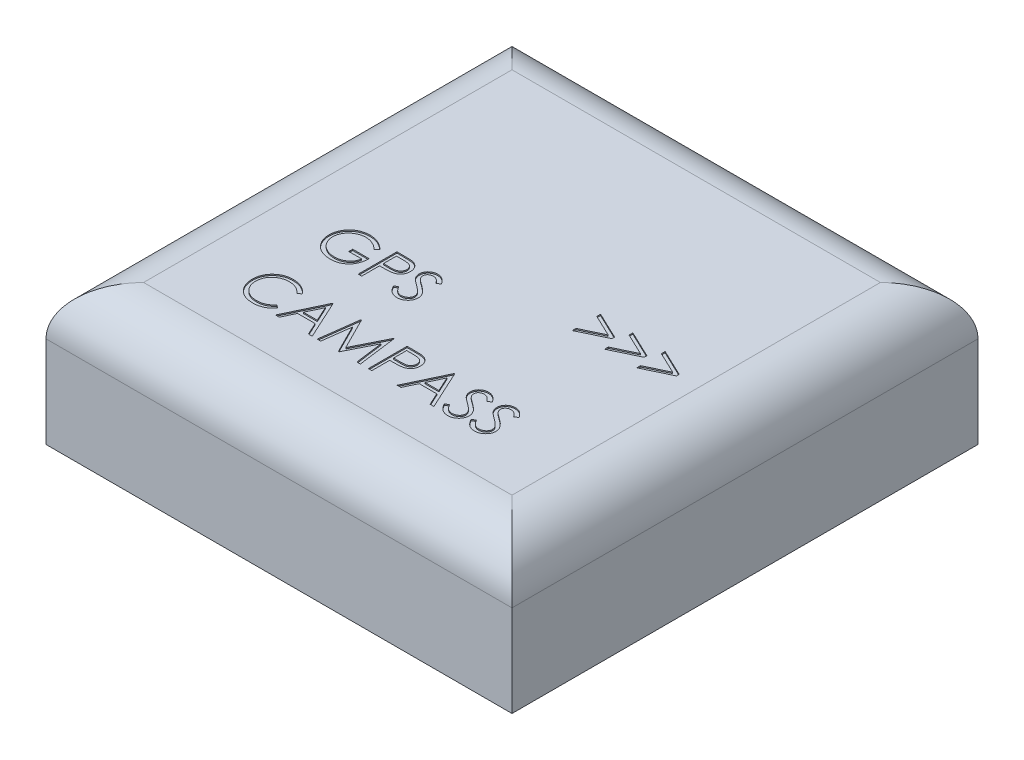
from build123d import *

# Parameters (mm, degrees)
SKETCH2_W           = 38.2
SKETCH2_H           = 38.2
BOSS_EXTRUDE1_DEPTH = 11.5
CUT_EXTRUDE1_DEPTH  = 0.1
FILLET1_R           = 4
SKETCH5_W           = 9.4
SKETCH5_H           = 4
CUT_EXTRUDE2_DEPTH  = 3


with BuildPart() as part:
    # Sketch2 → Boss-Extrude1 (new body)
    with BuildSketch(Plane(origin=(0, 0, 0), x_dir=(1, 0, 0), z_dir=(0, 1, 0))):
        Rectangle(SKETCH2_W, SKETCH2_H)
    extrude(amount=BOSS_EXTRUDE1_DEPTH)

    # Sketch4 → Cut-Extrude1 (cut)
    # profile 1 of 13: a face of its own
    with BuildSketch(Plane(origin=(0, 11.5, 0), x_dir=(1, 0, 0), z_dir=(0, 1, 0))):
        Polygon((5.884704752, -0.633123186), (7.666826146, 0.217232383), (5.884704752, 1.067587952), (5.884704752, 1.377328537), (8.082781675, 0.328535468), (8.082781675, 0.105929298), (5.884704752, -0.942863771), align=None)
    # profile 2 of 13: a face of its own
    with BuildSketch(Plane(origin=(0, 11.5, 0), x_dir=(1, 0, 0), z_dir=(0, 1, 0))):
        Polygon((8.530538085, -0.633123186), (10.312659479, 0.217232383), (8.530538085, 1.067587952), (8.530538085, 1.377328537), (10.728615008, 0.328535468), (10.728615008, 0.105929298), (8.530538085, -0.942863771), align=None)
    # profile 3 of 13: a face of its own
    with BuildSketch(Plane(origin=(0, 11.5, 0), x_dir=(1, 0, 0), z_dir=(0, 1, 0))):
        Polygon((11.176371418, -0.633123186), (12.958492813, 0.217232383), (11.176371418, 1.067587952), (11.176371418, 1.377328537), (13.374448341, 0.328535468), (13.374448341, 0.105929298), (11.176371418, -0.942863771), align=None)
    # profile 4 of 13: a face of its own
    with BuildSketch(Plane(origin=(0, 11.5, 0), x_dir=(1, 0, 0), z_dir=(0, 1, 0))):
        with BuildLine():
            Line((-7.751098915, -3.078066088), (-7.995329685, -3.309576505))
            add(Edge.make_bspline(
                [(-7.995329685, -3.309576505), (-8.039524676, -3.268001365), (-8.126860804, -3.185842468), (-8.269246167, -3.079243208), (-8.417803178, -2.987924674), (-8.571756657, -2.913624017), (-8.72729406, -2.854339727), (-8.882350878, -2.812132057), (-9.035336621, -2.785214827), (-9.137088312, -2.781995949), (-9.18722672, -2.780409838)],
                knots=[0, 0, 0, 0, 1.08915593, 2.152340314, 3.188132944, 4.216796309, 5.218260357, 6.173443236, 7.099959455, 8, 8, 8, 8], degree=3))
            add(Edge.make_bspline(
                [(-9.18722672, -2.780409838), (-9.217992198, -2.780785038), (-9.279443362, -2.781534464), (-9.370721839, -2.791099574), (-9.461043003, -2.804856272), (-9.55023635, -2.824760689), (-9.638475303, -2.849987479), (-9.725452969, -2.881542863), (-9.811331598, -2.918332264), (-9.895302257, -2.960843222), (-9.976709714, -3.007542797), (-10.053596272, -3.059293973), (-10.126451998, -3.11443809), (-10.193907527, -3.174355764), (-10.256350875, -3.238504249), (-10.315268327, -3.305690248), (-10.368587731, -3.377749339), (-10.416749002, -3.453355728), (-10.459712756, -3.5311815), (-10.497639177, -3.610477569), (-10.52947725, -3.690980923), (-10.554668113, -3.772792579), (-10.575451349, -3.855279614), (-10.590072321, -3.939013182), (-10.598315276, -4.024082939), (-10.599741105, -4.081049024), (-10.60045789, -4.109686681)],
                knots=[0, 0, 0, 0, 1.02818874, 2.053710826, 3.065248034, 4.081641283, 5.106893873, 6.131558223, 7.173050175, 8.228653731, 9.27666206, 10.308777013, 11.325269123, 12.329503258, 13.32196095, 14.316845687, 15.314881793, 16.315733098, 17.311955233, 18.285320748, 19.252783886, 20.203351036, 21.145449891, 22.095197417, 23.042428769, 24, 24, 24, 24], degree=3))
            add(Edge.make_bspline(
                [(-10.60045789, -4.109686681), (-10.599772345, -4.138960922), (-10.598403128, -4.197429467), (-10.589639839, -4.284691233), (-10.573376363, -4.370656991), (-10.551634227, -4.455609226), (-10.524437345, -4.539693429), (-10.490534998, -4.622545063), (-10.450379774, -4.704161061), (-10.403900902, -4.783806042), (-10.352931989, -4.861387642), (-10.295833623, -4.934466636), (-10.235181522, -5.00401617), (-10.168766056, -5.068492042), (-10.098716899, -5.129618862), (-10.022941192, -5.185712514), (-9.94292896, -5.237853473), (-9.858558132, -5.285384602), (-9.770744179, -5.327846631), (-9.680704125, -5.365605451), (-9.588150321, -5.396701707), (-9.493569166, -5.422045558), (-9.397073413, -5.442819399), (-9.298173249, -5.456183863), (-9.197595863, -5.465881974), (-9.129797247, -5.466591061), (-9.095640181, -5.4669483)],
                knots=[0, 0, 0, 0, 0.93586088, 1.869166235, 2.799637598, 3.729985548, 4.670839027, 5.622275134, 6.589130586, 7.576015415, 8.568469353, 9.55398029, 10.53834874, 11.515998671, 12.510579167, 13.508179873, 14.527009472, 15.561807829, 16.601455013, 17.643573243, 18.680854198, 19.719860599, 20.772568776, 21.833555941, 22.908541556, 24, 24, 24, 24], degree=3))
            add(Edge.make_bspline(
                [(-9.095640181, -5.4669483), (-9.054475538, -5.466087806), (-8.973642072, -5.464398085), (-8.854818656, -5.451244251), (-8.740697299, -5.430700374), (-8.631598672, -5.400614168), (-8.527396061, -5.362238691), (-8.427707464, -5.315978591), (-8.333317745, -5.26005953), (-8.243943152, -5.196946093), (-8.161613419, -5.126629067), (-8.087360035, -5.050751597), (-8.022367341, -4.969681994), (-7.96566665, -4.883897743), (-7.918759513, -4.792688788), (-7.880257835, -4.696502106), (-7.850745492, -4.595294435), (-7.838630622, -4.525361312), (-7.832509172, -4.490025223)],
                knots=[0, 0, 0, 0, 1.13008108, 2.219097802, 3.278683437, 4.311054135, 5.322181354, 6.324827112, 7.324222904, 8.330512327, 9.32562643, 10.293043162, 11.24128371, 12.174520618, 13.111833804, 14.052305215, 15.015860969, 16, 16, 16, 16], degree=3))
            Line((-7.832509172, -4.490025223), (-8.890842505, -4.490025223))
            Line((-8.890842505, -4.490025223), (-8.890842505, -4.164384197))
            Line((-8.890842505, -4.164384197), (-7.547573274, -4.164384197))
            add(Edge.make_bspline(
                [(-7.547573274, -4.164384197), (-7.549120723, -4.225078848), (-7.552149358, -4.343869243), (-7.57339366, -4.51710656), (-7.607698639, -4.680729453), (-7.654561922, -4.83491024), (-7.715227355, -4.979430427), (-7.789043863, -5.114436749), (-7.877192858, -5.239057023), (-7.976534473, -5.35430862), (-8.088022292, -5.457114405), (-8.208643826, -5.54747122), (-8.338598361, -5.623582878), (-8.477762973, -5.685505051), (-8.62568208, -5.733832175), (-8.782697967, -5.768096391), (-8.948597705, -5.788625), (-9.062295976, -5.791247894), (-9.120444869, -5.792589325)],
                knots=[0, 0, 0, 0, 1.140356446, 2.231883559, 3.274166699, 4.278491846, 5.25512956, 6.21435461, 7.1637429, 8.11826594, 9.068280886, 10.0076534, 10.945064095, 11.891975133, 12.864533718, 13.863980011, 14.907571808, 16, 16, 16, 16], degree=3))
            add(Edge.make_bspline(
                [(-9.120444869, -5.792589325), (-9.156286206, -5.792073051), (-9.226976874, -5.791054792), (-9.331380788, -5.783818198), (-9.432906058, -5.772677961), (-9.531537894, -5.755854885), (-9.627639105, -5.735249449), (-9.720729728, -5.708863639), (-9.81116438, -5.678321319), (-9.899082838, -5.643581673), (-9.983687106, -5.603330241), (-10.065354018, -5.558599354), (-10.144535003, -5.509619662), (-10.220690703, -5.455544109), (-10.294217916, -5.396777163), (-10.36464254, -5.333201037), (-10.43235883, -5.265010093), (-10.47477725, -5.216587705), (-10.496150999, -5.192188684)],
                knots=[0, 0, 0, 0, 1.107784379, 2.184907829, 3.233506516, 4.263428166, 5.276301166, 6.270063455, 7.25232949, 8.225834625, 9.190232166, 10.146266622, 11.1027726, 12.066435141, 13.031522626, 14.010570082, 14.99756817, 16, 16, 16, 16], degree=3))
            add(Edge.make_bspline(
                [(-10.496150999, -5.192188684), (-10.527162523, -5.153480306), (-10.588670811, -5.076706069), (-10.667844568, -4.953697548), (-10.735337269, -4.826333004), (-10.790099507, -4.694257877), (-10.832860486, -4.557595705), (-10.863527586, -4.416521119), (-10.881495627, -4.270852454), (-10.884084193, -4.172277536), (-10.885393787, -4.122407034)],
                knots=[0, 0, 0, 0, 1.023165419, 2.029347347, 3.013907458, 3.994755782, 4.975994455, 5.96558838, 6.970761222, 8, 8, 8, 8], degree=3))
            add(Edge.make_bspline(
                [(-10.885393787, -4.122407034), (-10.884910971, -4.085063362), (-10.883951475, -4.010850633), (-10.8723169, -3.900671504), (-10.855624185, -3.792448733), (-10.831088643, -3.686270786), (-10.80015846, -3.582066749), (-10.761556369, -3.479788239), (-10.71661207, -3.379374898), (-10.664373799, -3.281517889), (-10.606240039, -3.187515743), (-10.543148054, -3.097746879), (-10.474201931, -3.013846084), (-10.400527598, -2.934750803), (-10.321246043, -2.861454706), (-10.237099994, -2.793279192), (-10.148024605, -2.730132809), (-10.053739641, -2.673010173), (-9.955652385, -2.621698889), (-9.853997955, -2.57671439), (-9.748807383, -2.539536668), (-9.640868742, -2.507991882), (-9.52936501, -2.484664576), (-9.415105344, -2.4677475), (-9.297494171, -2.456171813), (-9.217995773, -2.455240852), (-9.177686455, -2.454768813)],
                knots=[0, 0, 0, 0, 1.008945113, 2.00506715, 2.99143336, 3.967273523, 4.948097931, 5.927297278, 6.919902385, 7.919676788, 8.923139349, 9.905703106, 10.883022732, 11.856032218, 12.825136022, 13.798837087, 14.781400844, 15.773989409, 16.776158564, 17.77167057, 18.775803737, 19.789618931, 20.80898985, 21.851988756, 22.910860228, 24, 24, 24, 24], degree=3))
            add(Edge.make_bspline(
                [(-9.177686455, -2.454768813), (-9.144813192, -2.455294494), (-9.079629372, -2.45633686), (-8.982632458, -2.463561933), (-8.887134795, -2.475013597), (-8.792994784, -2.490640753), (-8.700533009, -2.511925672), (-8.609486069, -2.537396688), (-8.519721982, -2.567052841), (-8.431522071, -2.602421295), (-8.344293285, -2.642565654), (-8.257550616, -2.687753545), (-8.171590443, -2.738757656), (-8.086263695, -2.795729435), (-8.00103231, -2.857690392), (-7.917244384, -2.926412654), (-7.832877428, -2.999186154), (-7.778628639, -3.051512135), (-7.751098915, -3.078066088)],
                knots=[0, 0, 0, 0, 0.985871117, 1.954866573, 2.915460327, 3.869826059, 4.81536089, 5.759505086, 6.70452669, 7.649098992, 8.607881297, 9.583363685, 10.581137262, 11.603961102, 12.659522466, 13.73993555, 14.853081303, 16, 16, 16, 16], degree=3))
        make_face()
    # profile 5 of 13: a face of its own
    with BuildSketch(Plane(origin=(0, 11.5, 0), x_dir=(1, 0, 0), z_dir=(0, 1, 0))):
        with BuildLine():
            Line((-6.896291223, -2.536179069), (-6.273629965, -2.536179069))
            add(Edge.make_bspline(
                [(-6.273629965, -2.536179069), (-6.230802929, -2.536226146), (-6.148744425, -2.536316348), (-6.031074339, -2.539051154), (-5.924204083, -2.542703939), (-5.828364094, -2.547767513), (-5.743259491, -2.553751563), (-5.669275369, -2.562144484), (-5.6058302, -2.570907752), (-5.567815064, -2.579817171), (-5.550477922, -2.583880391)],
                knots=[0, 0, 0, 0, 1.415646017, 2.712440637, 3.8905458, 4.950247383, 5.884950622, 6.709939814, 7.411656543, 8, 8, 8, 8], degree=3))
            add(Edge.make_bspline(
                [(-5.550477922, -2.583880391), (-5.52853093, -2.589887446), (-5.485154101, -2.601760006), (-5.422651012, -2.625539598), (-5.363184309, -2.653735562), (-5.306549967, -2.685870136), (-5.253443935, -2.723322041), (-5.203073883, -2.764573108), (-5.15588433, -2.810575745), (-5.112140638, -2.860813988), (-5.071968001, -2.914444464), (-5.037378931, -2.972267773), (-5.008416375, -3.033310598), (-4.983575836, -3.09753048), (-4.965697452, -3.165466702), (-4.952229193, -3.23664722), (-4.943680617, -3.311064403), (-4.942861864, -3.361918712), (-4.942445069, -3.387806673)],
                knots=[0, 0, 0, 0, 0.999701418, 1.975846123, 2.934577507, 3.890451536, 4.834027766, 5.787354733, 6.749476667, 7.726910423, 8.712836071, 9.690891519, 10.682875813, 11.679750201, 12.712814741, 13.765529915, 14.8625177, 16, 16, 16, 16], degree=3))
            add(Edge.make_bspline(
                [(-4.942445069, -3.387806673), (-4.942827362, -3.413912228), (-4.943575343, -3.464989509), (-4.952552687, -3.539713395), (-4.964645075, -3.61112222), (-4.98323883, -3.67905765), (-5.007591691, -3.743116242), (-5.036159481, -3.804276931), (-5.07061597, -3.861499205), (-5.110208065, -3.914990805), (-5.154251297, -3.964801939), (-5.20255932, -4.010571646), (-5.254937106, -4.05203201), (-5.311218198, -4.089275979), (-5.371951275, -4.12143989), (-5.436215229, -4.150248302), (-5.504568639, -4.174442764), (-5.551869348, -4.187170034), (-5.575918627, -4.193641008)],
                knots=[0, 0, 0, 0, 1.121902311, 2.195077645, 3.232258892, 4.234102512, 5.217864754, 6.176164875, 7.132989551, 8.084763148, 9.034132444, 9.988522005, 10.94243251, 11.903244335, 12.886203696, 13.894208494, 14.929344452, 16, 16, 16, 16], degree=3))
            add(Edge.make_bspline(
                [(-5.575918627, -4.193641008), (-5.595809851, -4.197870998), (-5.639402626, -4.207141267), (-5.711196381, -4.217490367), (-5.79478541, -4.226323762), (-5.890055621, -4.232946937), (-5.996921499, -4.238616914), (-6.115440854, -4.243123685), (-6.245846338, -4.245600052), (-6.336806681, -4.245727771), (-6.384297032, -4.245794454)],
                knots=[0, 0, 0, 0, 0.601384939, 1.31797006, 2.144135048, 3.087295005, 4.142315834, 5.309527816, 6.595305764, 8, 8, 8, 8], degree=3))
            Line((-6.384297032, -4.245794454), (-6.611355326, -4.245794454))
            Line((-6.611355326, -4.245794454), (-6.611355326, -5.711179069))
            Line((-6.611355326, -5.711179069), (-6.896291223, -5.711179069))
            Line((-6.896291223, -5.711179069), (-6.896291223, -2.536179069))
        make_face()
        with BuildLine():
            Line((-6.611355326, -2.861820095), (-6.611355326, -3.920153428))
            Line((-6.611355326, -3.920153428), (-6.055475919, -3.927149622))
            add(Edge.make_bspline(
                [(-6.055475919, -3.927149622), (-6.028334272, -3.92716365), (-5.975937882, -3.92719073), (-5.900249308, -3.923575563), (-5.830028026, -3.919402222), (-5.765489732, -3.913291777), (-5.706605335, -3.904654637), (-5.653276648, -3.895935417), (-5.605917184, -3.883321267), (-5.550491479, -3.866336769), (-5.488730157, -3.837369324), (-5.42154031, -3.795323353), (-5.36459842, -3.74172871), (-5.315323966, -3.681469178), (-5.276220776, -3.61443211), (-5.247594983, -3.542705289), (-5.230775505, -3.467024311), (-5.228520172, -3.415237214), (-5.227380967, -3.389078708)],
                knots=[0, 0, 0, 0, 1.160613943, 2.240541288, 3.23993089, 4.169200891, 5.011653406, 5.7853311, 6.478053781, 7.106038997, 8.262395093, 9.384106736, 10.481365981, 11.59014053, 12.70357646, 13.786202915, 14.881775077, 16, 16, 16, 16], degree=3))
            add(Edge.make_bspline(
                [(-5.227380967, -3.389078708), (-5.228526367, -3.363553057), (-5.230803282, -3.312811221), (-5.247726815, -3.238444774), (-5.276165122, -3.167473813), (-5.315586461, -3.1012768), (-5.3634302, -3.0412341), (-5.419037461, -2.989075991), (-5.482277348, -2.947146304), (-5.541103958, -2.920083256), (-5.593356463, -2.903559399), (-5.638742598, -2.891998008), (-5.689987709, -2.882767279), (-5.747108481, -2.875292873), (-5.80966218, -2.868894376), (-5.878186223, -2.864552811), (-5.952421028, -2.86201149), (-6.003956331, -2.861885438), (-6.030671231, -2.861820095)],
                knots=[0, 0, 0, 0, 1.120700087, 2.227813068, 3.331159281, 4.466773991, 5.599788987, 6.693661531, 7.80175334, 8.91857717, 9.525282508, 10.207424825, 10.974604443, 11.810962634, 12.737642355, 13.736264703, 14.826523623, 16, 16, 16, 16], degree=3))
            Line((-6.030671231, -2.861820095), (-6.611355326, -2.861820095))
        make_face(mode=Mode.SUBTRACT)
    # profile 6 of 13: a face of its own
    with BuildSketch(Plane(origin=(0, 11.5, 0), x_dir=(1, 0, 0), z_dir=(0, 1, 0))):
        with BuildLine():
            Line((-4.616804044, -5.098694093), (-4.348404604, -4.937781633))
            add(Edge.make_bspline(
                [(-4.348404604, -4.937781633), (-4.323441632, -4.979568611), (-4.27561354, -5.059630848), (-4.195829093, -5.167814927), (-4.113158524, -5.259764884), (-4.026989628, -5.334945806), (-3.937848375, -5.394135868), (-3.845152841, -5.436047892), (-3.749215398, -5.462188099), (-3.68392486, -5.465363177), (-3.651329284, -5.4669483)],
                knots=[0, 0, 0, 0, 1.272034388, 2.437168799, 3.508375237, 4.49857839, 5.41946034, 6.295179144, 7.148887113, 8, 8, 8, 8], degree=3))
            add(Edge.make_bspline(
                [(-3.651329284, -5.4669483), (-3.623491918, -5.46617299), (-3.568304274, -5.464635936), (-3.487058525, -5.449866922), (-3.408153604, -5.427177348), (-3.333215768, -5.394682646), (-3.263279032, -5.355368448), (-3.201950101, -5.307882987), (-3.148931127, -5.254718786), (-3.105561431, -5.195407378), (-3.072287399, -5.131619679), (-3.046713165, -5.06614578), (-3.032520848, -4.997957151), (-3.030382936, -4.952046231), (-3.029304044, -4.928877386)],
                knots=[0, 0, 0, 0, 1.095163259, 2.171163733, 3.241058638, 4.321873601, 5.38011039, 6.391990106, 7.366004449, 8.327778327, 9.272591725, 10.192022065, 11.087607919, 12, 12, 12, 12], degree=3))
            add(Edge.make_bspline(
                [(-3.029304044, -4.928877386), (-3.030641454, -4.902442473), (-3.033360214, -4.848704156), (-3.056339485, -4.769420185), (-3.092488445, -4.690959068), (-3.125837414, -4.642425777), (-3.143151199, -4.617228748)],
                knots=[0, 0, 0, 0, 0.938893495, 1.908633276, 2.914225137, 4, 4, 4, 4], degree=3))
            add(Edge.make_bspline(
                [(-3.143151199, -4.617228748), (-3.157366685, -4.599043416), (-3.187210319, -4.560865584), (-3.238516062, -4.504037406), (-3.298719609, -4.445419269), (-3.365760691, -4.382772839), (-3.442081422, -4.319011766), (-3.525291381, -4.251095542), (-3.617515025, -4.181606969), (-3.682193854, -4.135004713), (-3.715567064, -4.110958716)],
                knots=[0, 0, 0, 0, 0.722233717, 1.516239348, 2.393582979, 3.351407094, 4.387010283, 5.505090956, 6.712668013, 8, 8, 8, 8], degree=3))
            add(Edge.make_bspline(
                [(-3.715567064, -4.110958716), (-3.74897169, -4.087165641), (-3.812838789, -4.041675091), (-3.902154789, -3.974161634), (-3.982023694, -3.912436123), (-4.052090517, -3.855917484), (-4.112324437, -3.804598049), (-4.163200102, -3.758970633), (-4.203421508, -3.71780126), (-4.225787642, -3.691093757), (-4.235829484, -3.679102747)],
                knots=[0, 0, 0, 0, 1.452282411, 2.77665338, 3.964542531, 5.026858415, 5.96415736, 6.766646006, 7.446254459, 8, 8, 8, 8], degree=3))
            add(Edge.make_bspline(
                [(-4.235829484, -3.679102747), (-4.249865293, -3.660414663), (-4.277468595, -3.623662039), (-4.3139049, -3.566217347), (-4.344873998, -3.507413385), (-4.369151256, -3.447092136), (-4.389594826, -3.386100451), (-4.403345235, -3.323642535), (-4.411955288, -3.259998645), (-4.412837018, -3.217169255), (-4.413278403, -3.195729349)],
                knots=[0, 0, 0, 0, 1.068054152, 2.10047183, 3.106115577, 4.101338837, 5.06977816, 6.043150881, 7.020423561, 8, 8, 8, 8], degree=3))
            add(Edge.make_bspline(
                [(-4.413278403, -3.195729349), (-4.412094392, -3.162138054), (-4.409751677, -3.095673453), (-4.389939208, -2.9985812), (-4.358667368, -2.905883521), (-4.314857006, -2.818498147), (-4.258380693, -2.738700436), (-4.193024702, -2.665572487), (-4.115181425, -2.604096702), (-4.029771545, -2.550382906), (-3.936284694, -2.508340531), (-3.838321517, -2.476625928), (-3.735726316, -2.458656101), (-3.666236329, -2.456077307), (-3.63097672, -2.454768813)],
                knots=[0, 0, 0, 0, 1.005424448, 1.989358655, 2.955360095, 3.929531133, 4.905563448, 5.876582895, 6.856512386, 7.866279853, 8.892233794, 9.918561126, 10.94386622, 12, 12, 12, 12], degree=3))
            add(Edge.make_bspline(
                [(-3.63097672, -2.454768813), (-3.593562429, -2.45605927), (-3.519157346, -2.458625578), (-3.409711271, -2.480939053), (-3.304336907, -2.517860377), (-3.219570517, -2.559760088), (-3.153228655, -2.601607872), (-3.102634819, -2.639725856), (-3.051365417, -2.68360899), (-2.999006896, -2.733374163), (-2.94644644, -2.789478002), (-2.892903737, -2.851536269), (-2.838253579, -2.919169716), (-2.803096478, -2.967451942), (-2.785073274, -2.992203708)],
                knots=[0, 0, 0, 0, 1.286793592, 2.559021753, 3.825965368, 5.121522368, 5.803751409, 6.523245864, 7.299691795, 8.125521123, 9.008227632, 9.944561021, 10.946284179, 12, 12, 12, 12], degree=3))
            Line((-2.785073274, -2.992203708), (-3.042660414, -3.18746112))
            add(Edge.make_bspline(
                [(-3.042660414, -3.18746112), (-3.058214224, -3.167423523), (-3.088167226, -3.128835794), (-3.133641832, -3.074796101), (-3.176503105, -3.02543258), (-3.218730968, -2.982556357), (-3.258095191, -2.943819422), (-3.296301365, -2.910654499), (-3.332799669, -2.882736638), (-3.378807152, -2.852942837), (-3.436608225, -2.823409437), (-3.509165626, -2.798418488), (-3.584990318, -2.783400682), (-3.636633627, -2.781415048), (-3.662777601, -2.780409838)],
                knots=[0, 0, 0, 0, 1.181633172, 2.275549214, 3.290209073, 4.226197932, 5.078386478, 5.862611352, 6.581680152, 7.217281963, 8.414376989, 9.595101626, 10.782541182, 12, 12, 12, 12], degree=3))
            add(Edge.make_bspline(
                [(-3.662777601, -2.780409838), (-3.695576732, -2.781509023), (-3.758826767, -2.783628698), (-3.848625052, -2.80677897), (-3.92944597, -2.843229658), (-3.998890083, -2.894315388), (-4.056708626, -2.95484086), (-4.098532864, -3.02449025), (-4.123706227, -3.101400001), (-4.126778067, -3.155049932), (-4.128342505, -3.182372979)],
                knots=[0, 0, 0, 0, 1.14458467, 2.207223713, 3.21896685, 4.227309161, 5.202851033, 6.127160689, 7.046193047, 8, 8, 8, 8], degree=3))
            add(Edge.make_bspline(
                [(-4.128342505, -3.182372979), (-4.127985883, -3.199383249), (-4.127272056, -3.233431604), (-4.117316347, -3.283733965), (-4.104526241, -3.333909252), (-4.084258282, -3.38373188), (-4.056277185, -3.434073192), (-4.019533204, -3.485800054), (-3.973256843, -3.539368389), (-3.93780841, -3.574209364), (-3.919092705, -3.592604349)],
                knots=[0, 0, 0, 0, 0.858281714, 1.717966888, 2.583508476, 3.4729293, 4.427298488, 5.488583878, 6.674047936, 8, 8, 8, 8], degree=3))
            add(Edge.make_bspline(
                [(-3.919092705, -3.592604349), (-3.912142746, -3.598806509), (-3.895631234, -3.613541419), (-3.865445216, -3.637664416), (-3.82558282, -3.667421217), (-3.777084966, -3.704239711), (-3.719057431, -3.746949323), (-3.651493833, -3.795003957), (-3.5751473, -3.849963624), (-3.520970991, -3.888387964), (-3.492324877, -3.908705111)],
                knots=[0, 0, 0, 0, 0.420754252, 0.999615792, 1.744751191, 2.668019286, 3.750313428, 4.999500688, 6.413464383, 8, 8, 8, 8], degree=3))
            add(Edge.make_bspline(
                [(-3.492324877, -3.908705111), (-3.457866227, -3.933779773), (-3.391141827, -3.98233338), (-3.296202451, -4.05528189), (-3.210120211, -4.126626651), (-3.132592876, -4.195912052), (-3.062854538, -4.262612536), (-3.001678891, -4.327530564), (-2.948442596, -4.390201048), (-2.891130019, -4.470549027), (-2.832566854, -4.569229011), (-2.782273487, -4.690131413), (-2.750561271, -4.811503789), (-2.746414254, -4.893080277), (-2.744368146, -4.93332951)],
                knots=[0, 0, 0, 0, 1.163667725, 2.253281268, 3.268753668, 4.215851969, 5.092017293, 5.902905408, 6.650798638, 7.335211899, 8.59617414, 9.77448103, 10.901945474, 12, 12, 12, 12], degree=3))
            add(Edge.make_bspline(
                [(-2.744368146, -4.93332951), (-2.744964264, -4.961794169), (-2.746144924, -5.018170725), (-2.75971661, -5.100952116), (-2.779600878, -5.181352976), (-2.809570369, -5.258379485), (-2.846149234, -5.333440806), (-2.89256433, -5.404567972), (-2.946364873, -5.473335205), (-3.008081217, -5.537908801), (-3.075614285, -5.597187136), (-3.146991637, -5.649918499), (-3.222330099, -5.693886192), (-3.301220972, -5.729764456), (-3.383682377, -5.757825576), (-3.469686581, -5.77815725), (-3.559375352, -5.790635645), (-3.620335789, -5.791930828), (-3.651329284, -5.792589325)],
                knots=[0, 0, 0, 0, 0.983748083, 1.948392443, 2.894712957, 3.844097841, 4.80183111, 5.778335162, 6.776009319, 7.81870978, 8.863265674, 9.881300176, 10.883814829, 11.87499822, 12.874611388, 13.892143829, 14.928324115, 16, 16, 16, 16], degree=3))
            add(Edge.make_bspline(
                [(-3.651329284, -5.792589325), (-3.675309917, -5.792125611), (-3.72296917, -5.791204021), (-3.793462772, -5.783056717), (-3.862532256, -5.771529559), (-3.929310926, -5.753228795), (-3.99465915, -5.73102468), (-4.058292713, -5.703684907), (-4.120242454, -5.670921446), (-4.180855547, -5.633460959), (-4.239977834, -5.589865719), (-4.29705478, -5.539089762), (-4.353959113, -5.482533482), (-4.409011251, -5.418661043), (-4.463324746, -5.348504353), (-4.515828732, -5.271407023), (-4.567610004, -5.187788995), (-4.60009975, -5.128947095), (-4.616804044, -5.098694093)],
                knots=[0, 0, 0, 0, 0.915332311, 1.819136955, 2.706846663, 3.586547465, 4.459518054, 5.340707479, 6.227863349, 7.133153174, 8.059268498, 9.028702269, 10.047606654, 11.120612155, 12.245963614, 13.433783089, 14.680604001, 16, 16, 16, 16], degree=3))
        make_face()
    # profile 7 of 13: a face of its own
    with BuildSketch(Plane(origin=(0, 11.5, 0), x_dir=(1, 0, 0), z_dir=(0, 1, 0))):
        with BuildLine():
            Line((-7.791804044, -9.410437883), (-8.041122954, -9.601243172))
            add(Edge.make_bspline(
                [(-8.041122954, -9.601243172), (-8.058908295, -9.580046899), (-8.094239194, -9.537940125), (-8.151080042, -9.478812967), (-8.210317961, -9.423418051), (-8.271930306, -9.371491489), (-8.337026079, -9.324849137), (-8.404028375, -9.281060351), (-8.47405803, -9.241810332), (-8.570897104, -9.194218909), (-8.697577652, -9.144556325), (-8.857048684, -9.102915537), (-9.023519467, -9.076407756), (-9.137091575, -9.073536793), (-9.194858931, -9.072076505)],
                knots=[0, 0, 0, 0, 0.757959112, 1.505699292, 2.245454638, 2.979532153, 3.711538275, 4.438200793, 5.171680507, 5.909471876, 7.393775596, 8.890124382, 10.418191784, 12, 12, 12, 12], degree=3))
            add(Edge.make_bspline(
                [(-9.194858931, -9.072076505), (-9.226684496, -9.072442957), (-9.290040253, -9.073172459), (-9.384064226, -9.082796451), (-9.476332494, -9.096323049), (-9.566785038, -9.116393878), (-9.655306722, -9.141769039), (-9.742476258, -9.172090665), (-9.827031588, -9.209605412), (-9.910142418, -9.251069334), (-9.989770702, -9.297902802), (-10.065113496, -9.348987057), (-10.135896009, -9.403750451), (-10.202174236, -9.462398241), (-10.264015932, -9.524666305), (-10.320972993, -9.591218243), (-10.372848329, -9.661841286), (-10.420670202, -9.735604163), (-10.463498896, -9.812292017), (-10.499358143, -9.892188688), (-10.53111279, -9.973925981), (-10.55623996, -10.058427392), (-10.576128629, -10.145098329), (-10.589851581, -10.234171401), (-10.599366122, -10.325460525), (-10.600091997, -10.387336116), (-10.60045789, -10.418525824)],
                knots=[0, 0, 0, 0, 1.054917814, 2.100044995, 3.131103042, 4.146048494, 5.169673617, 6.183595914, 7.203665975, 8.234915748, 9.262203917, 10.264457458, 11.251630812, 12.227803204, 13.197192746, 14.159520551, 15.12972552, 16.100847026, 17.073214652, 18.039054194, 19.002613845, 19.979014051, 20.95965708, 21.949030935, 22.966165397, 24, 24, 24, 24], degree=3))
            add(Edge.make_bspline(
                [(-10.60045789, -10.418525824), (-10.59931324, -10.465453521), (-10.597065871, -10.55758983), (-10.577064882, -10.692546027), (-10.546670978, -10.821832638), (-10.501118276, -10.944641495), (-10.444948852, -11.062486934), (-10.37397344, -11.173375037), (-10.291771295, -11.278981492), (-10.1971795, -11.376810452), (-10.093397082, -11.466176474), (-9.98204719, -11.544871644), (-9.863407158, -11.610471573), (-9.738786929, -11.665059753), (-9.607227526, -11.707021213), (-9.468965526, -11.736561526), (-9.324301645, -11.755831218), (-9.225450832, -11.757676063), (-9.175142385, -11.758614966)],
                knots=[0, 0, 0, 0, 1.029171465, 2.020641659, 2.987623507, 3.938342917, 4.889210282, 5.84687017, 6.821220943, 7.821438502, 8.827599549, 9.822697543, 10.807740252, 11.797342354, 12.80366471, 13.83203677, 14.896651826, 16, 16, 16, 16], degree=3))
            add(Edge.make_bspline(
                [(-9.175142385, -11.758614966), (-9.119713517, -11.757083002), (-9.010616245, -11.754067729), (-8.85062525, -11.728523268), (-8.697467091, -11.687105014), (-8.551133531, -11.62914047), (-8.412037102, -11.553788387), (-8.279960131, -11.462441027), (-8.154791135, -11.354229468), (-8.079524329, -11.271604059), (-8.041122954, -11.2294483)],
                knots=[0, 0, 0, 0, 1.028121516, 2.023589091, 2.998037872, 3.967518031, 4.937445131, 5.927275754, 6.942489185, 8, 8, 8, 8], degree=3))
            Line((-8.041122954, -11.2294483), (-7.791804044, -11.418345535))
            add(Edge.make_bspline(
                [(-7.791804044, -11.418345535), (-7.811868329, -11.444233988), (-7.851900793, -11.49588689), (-7.916723423, -11.568704798), (-7.985010685, -11.637197744), (-8.057269794, -11.700813515), (-8.132669505, -11.760825066), (-8.212563674, -11.815527441), (-8.29590201, -11.865684172), (-8.382402145, -11.911610025), (-8.471972172, -11.952356385), (-8.564504767, -11.987239446), (-8.659601074, -12.017288452), (-8.757265443, -12.042009852), (-8.857700451, -12.061305764), (-8.960543667, -12.07420504), (-9.066017053, -12.083042349), (-9.137174628, -12.083847815), (-9.173234332, -12.084255992)],
                knots=[0, 0, 0, 0, 0.986787822, 1.968848986, 2.935600012, 3.899624008, 4.868462664, 5.837806735, 6.815139263, 7.798259679, 8.787526145, 9.778297419, 10.776456485, 11.791383307, 12.812564526, 13.85620153, 14.913611965, 16, 16, 16, 16], degree=3))
            add(Edge.make_bspline(
                [(-9.173234332, -12.084255992), (-9.207382516, -12.084018327), (-9.27490632, -12.083548375), (-9.374600188, -12.07593548), (-9.471655022, -12.065548933), (-9.565793432, -12.049909671), (-9.657529138, -12.031454449), (-9.746030526, -12.006715523), (-9.832168467, -11.979003065), (-9.91559689, -11.946432112), (-9.99638676, -11.909678147), (-10.074277504, -11.868138661), (-10.149233296, -11.82216297), (-10.221991071, -11.772764496), (-10.291476021, -11.718356515), (-10.358290291, -11.659694639), (-10.422808537, -11.596976587), (-10.462725259, -11.551751113), (-10.482794629, -11.529012603)],
                knots=[0, 0, 0, 0, 1.114604814, 2.203992996, 3.262667896, 4.300477797, 5.318619304, 6.316056647, 7.298880507, 8.271930387, 9.238335007, 10.195173496, 11.151986948, 12.108099108, 13.064862484, 14.031167946, 15.010108607, 16, 16, 16, 16], degree=3))
            add(Edge.make_bspline(
                [(-10.482794629, -11.529012603), (-10.514939819, -11.489514524), (-10.578842116, -11.410995223), (-10.660598986, -11.283735797), (-10.73058284, -11.150868207), (-10.787166711, -11.011694415), (-10.831401476, -10.866526713), (-10.862045846, -10.715291925), (-10.881959087, -10.558131292), (-10.884236278, -10.451236491), (-10.885393787, -10.396901224)],
                knots=[0, 0, 0, 0, 0.994628077, 1.977248131, 2.950237994, 3.925870899, 4.908910175, 5.911660606, 6.938484602, 8, 8, 8, 8], degree=3))
            add(Edge.make_bspline(
                [(-10.885393787, -10.396901224), (-10.883983004, -10.339791634), (-10.881207378, -10.227432081), (-10.857625477, -10.062537138), (-10.819689855, -9.904556941), (-10.765808392, -9.753786401), (-10.69749568, -9.609432504), (-10.613107252, -9.472597982), (-10.513623487, -9.342407743), (-10.399824622, -9.220837218), (-10.275031397, -9.10967652), (-10.141392187, -9.011880892), (-9.999168564, -8.930494288), (-9.84992737, -8.862462055), (-9.692551073, -8.810170292), (-9.527375445, -8.773564187), (-9.354710858, -8.750779374), (-9.236907086, -8.747899007), (-9.177050438, -8.746435479)],
                knots=[0, 0, 0, 0, 1.032925535, 2.032216505, 3.007276963, 3.968222605, 4.92396291, 5.891752235, 6.871517503, 7.883894988, 8.900124299, 9.891468569, 10.874487609, 11.85992873, 12.854644235, 13.869047385, 14.917252991, 16, 16, 16, 16], degree=3))
            add(Edge.make_bspline(
                [(-9.177050438, -8.746435479), (-9.140570167, -8.746872847), (-9.068361144, -8.747738574), (-8.961542667, -8.756180574), (-8.857545699, -8.770253631), (-8.756298594, -8.789408923), (-8.657308792, -8.813182708), (-8.561332859, -8.844152835), (-8.467807622, -8.879564546), (-8.377322926, -8.920348297), (-8.290312913, -8.966128841), (-8.206804681, -9.016398728), (-8.127461559, -9.071095637), (-8.051725247, -9.129754375), (-7.980862684, -9.193615925), (-7.912861914, -9.260923745), (-7.850032222, -9.333616571), (-7.811248966, -9.384783904), (-7.791804044, -9.410437883)],
                knots=[0, 0, 0, 0, 1.096760587, 2.17092713, 3.219439832, 4.250915756, 5.268269357, 6.278326846, 7.281116186, 8.274029601, 9.260640565, 10.235837813, 11.203064059, 12.156899882, 13.114053108, 14.069676657, 15.032185724, 16, 16, 16, 16], degree=3))
        make_face()
    # profile 8 of 13: a face of its own
    with BuildSketch(Plane(origin=(0, 11.5, 0), x_dir=(1, 0, 0), z_dir=(0, 1, 0))):
        Polygon((-5.83795789, -8.827845736), (-4.372573274, -12.002845736), (-4.682313859, -12.002845736), (-5.151694869, -10.985217531), (-6.591002762, -10.985217531), (-7.073740141, -12.002845736), (-7.384752762, -12.002845736), (-5.878663018, -8.827845736), align=None)
        Polygon((-5.861490542, -9.446690888), (-6.436450478, -10.659576505), (-5.301795029, -10.659576505), align=None, mode=Mode.SUBTRACT)
    # profile 9 of 13: a face of its own
    with BuildSketch(Plane(origin=(0, 11.5, 0), x_dir=(1, 0, 0), z_dir=(0, 1, 0))):
        Polygon((-3.965521992, -12.002845736), (-3.546386375, -8.827845736), (-3.505681247, -8.827845736), (-2.194848915, -11.432973941), (-0.887196672, -8.827845736), (-0.845855526, -8.827845736), (-0.424175838, -12.002845736), (-0.710383771, -12.002845736), (-1.014400197, -9.718270415), (-2.160503963, -12.002845736), (-2.224741744, -12.002845736), (-3.375297633, -9.713182274), (-3.678678042, -12.002845736), align=None)
    # profile 10 of 13: a face of its own
    with BuildSketch(Plane(origin=(0, 11.5, 0), x_dir=(1, 0, 0), z_dir=(0, 1, 0))):
        with BuildLine():
            Line((0.227106213, -8.827845736), (0.849767471, -8.827845736))
            add(Edge.make_bspline(
                [(0.849767471, -8.827845736), (0.892594507, -8.827892813), (0.974653011, -8.827983015), (1.092323097, -8.83071782), (1.199193353, -8.834370605), (1.295033342, -8.83943418), (1.380137945, -8.84541823), (1.454122067, -8.853811151), (1.517567236, -8.862574419), (1.555582372, -8.871483838), (1.572919514, -8.875547058)],
                knots=[0, 0, 0, 0, 1.415646017, 2.712440637, 3.8905458, 4.950247383, 5.884950622, 6.709939814, 7.411656543, 8, 8, 8, 8], degree=3))
            add(Edge.make_bspline(
                [(1.572919514, -8.875547058), (1.594866505, -8.881554112), (1.638243335, -8.893426673), (1.700746424, -8.917206265), (1.760213127, -8.945402229), (1.816847469, -8.977536803), (1.869953501, -9.014988707), (1.920323553, -9.056239775), (1.967513106, -9.102242412), (2.011256798, -9.152480655), (2.051429435, -9.206111131), (2.086018505, -9.263934439), (2.114981061, -9.324977265), (2.1398216, -9.389197147), (2.157699984, -9.457133369), (2.171168243, -9.528313887), (2.179716819, -9.60273107), (2.180535571, -9.653585378), (2.180952367, -9.67947334)],
                knots=[0, 0, 0, 0, 0.999701418, 1.975846123, 2.934577507, 3.890451536, 4.834027766, 5.787354733, 6.749476667, 7.726910423, 8.712836071, 9.690891519, 10.682875813, 11.679750201, 12.712814741, 13.765529915, 14.8625177, 16, 16, 16, 16], degree=3))
            add(Edge.make_bspline(
                [(2.180952367, -9.67947334), (2.180570074, -9.705578894), (2.179822093, -9.756656175), (2.170844749, -9.831380062), (2.158752361, -9.902788887), (2.140158606, -9.970724317), (2.115805745, -10.034782909), (2.087237955, -10.095943598), (2.052781466, -10.153165872), (2.013189371, -10.206657471), (1.969146139, -10.256468606), (1.920838116, -10.302238312), (1.86846033, -10.343698677), (1.812179238, -10.380942645), (1.751446161, -10.413106556), (1.687182207, -10.441914969), (1.618828797, -10.466109431), (1.571528088, -10.478836701), (1.547478809, -10.485307675)],
                knots=[0, 0, 0, 0, 1.121902311, 2.195077645, 3.232258892, 4.234102512, 5.217864754, 6.176164875, 7.132989551, 8.084763148, 9.034132444, 9.988522005, 10.94243251, 11.903244335, 12.886203696, 13.894208494, 14.929344452, 16, 16, 16, 16], degree=3))
            add(Edge.make_bspline(
                [(1.547478809, -10.485307675), (1.527587585, -10.489537665), (1.48399481, -10.498807934), (1.412201055, -10.509157034), (1.328612026, -10.517990429), (1.233341815, -10.524613604), (1.126475937, -10.530283581), (1.007956582, -10.534790352), (0.877551098, -10.537266719), (0.786590755, -10.537394438), (0.739100404, -10.53746112)],
                knots=[0, 0, 0, 0, 0.601384939, 1.31797006, 2.144135048, 3.087295005, 4.142315834, 5.309527816, 6.595305764, 8, 8, 8, 8], degree=3))
            Line((0.739100404, -10.53746112), (0.51204211, -10.53746112))
            Line((0.51204211, -10.53746112), (0.51204211, -12.002845736))
            Line((0.51204211, -12.002845736), (0.227106213, -12.002845736))
            Line((0.227106213, -12.002845736), (0.227106213, -8.827845736))
        make_face()
        with BuildLine():
            Line((0.51204211, -9.153486761), (0.51204211, -10.211820095))
            Line((0.51204211, -10.211820095), (1.067921517, -10.218816289))
            add(Edge.make_bspline(
                [(1.067921517, -10.218816289), (1.095063164, -10.218830316), (1.147459554, -10.218857396), (1.223148128, -10.215242229), (1.29336941, -10.211068889), (1.357907704, -10.204958444), (1.416792101, -10.196321303), (1.470120788, -10.187602084), (1.517480252, -10.174987934), (1.572905956, -10.158003435), (1.634667279, -10.129035991), (1.701857126, -10.086990019), (1.758799015, -10.033395377), (1.80807347, -9.973135844), (1.84717666, -9.906098777), (1.875802453, -9.834371956), (1.892621931, -9.758690978), (1.894877264, -9.70690388), (1.896016469, -9.680745375)],
                knots=[0, 0, 0, 0, 1.160613943, 2.240541288, 3.23993089, 4.169200891, 5.011653406, 5.7853311, 6.478053781, 7.106038997, 8.262395093, 9.384106736, 10.481365981, 11.59014053, 12.70357646, 13.786202915, 14.881775077, 16, 16, 16, 16], degree=3))
            add(Edge.make_bspline(
                [(1.896016469, -9.680745375), (1.894871068, -9.655219724), (1.892594154, -9.604477888), (1.875670621, -9.530111441), (1.847232314, -9.45914048), (1.807810975, -9.392943467), (1.759967236, -9.332900766), (1.704359975, -9.280742658), (1.641120087, -9.238812971), (1.582293478, -9.211749922), (1.530040973, -9.195226065), (1.484654838, -9.183664674), (1.433409727, -9.174433946), (1.376288955, -9.16695954), (1.313735256, -9.160561043), (1.245211213, -9.156219478), (1.170976408, -9.153678157), (1.119441104, -9.153552104), (1.092726205, -9.153486761)],
                knots=[0, 0, 0, 0, 1.120700087, 2.227813068, 3.331159281, 4.466773991, 5.599788987, 6.693661531, 7.80175334, 8.91857717, 9.525282508, 10.207424825, 10.974604443, 11.810962634, 12.737642355, 13.736264703, 14.826523623, 16, 16, 16, 16], degree=3))
            Line((1.092726205, -9.153486761), (0.51204211, -9.153486761))
        make_face(mode=Mode.SUBTRACT)
    # profile 11 of 13: a face of its own
    with BuildSketch(Plane(origin=(0, 11.5, 0), x_dir=(1, 0, 0), z_dir=(0, 1, 0))):
        Polygon((4.134798521, -8.827845736), (5.600183136, -12.002845736), (5.290442551, -12.002845736), (4.821061541, -10.985217531), (3.381753649, -10.985217531), (2.899016269, -12.002845736), (2.588003649, -12.002845736), (4.094093392, -8.827845736), align=None)
        Polygon((4.111265868, -9.446690888), (3.536305932, -10.659576505), (4.670961381, -10.659576505), align=None, mode=Mode.SUBTRACT)
    # profile 12 of 13: a face of its own
    with BuildSketch(Plane(origin=(0, 11.5, 0), x_dir=(1, 0, 0), z_dir=(0, 1, 0))):
        with BuildLine():
            Line((5.844413905, -11.39036076), (6.112813344, -11.2294483))
            add(Edge.make_bspline(
                [(6.112813344, -11.2294483), (6.137776317, -11.271235278), (6.185604408, -11.351297514), (6.265388856, -11.459481594), (6.348059425, -11.55143155), (6.43422832, -11.626612473), (6.523369573, -11.685802534), (6.616065108, -11.727714559), (6.71200255, -11.753854765), (6.777293088, -11.757029844), (6.809888665, -11.758614966)],
                knots=[0, 0, 0, 0, 1.272034388, 2.437168799, 3.508375237, 4.49857839, 5.41946034, 6.295179144, 7.148887113, 8, 8, 8, 8], degree=3))
            add(Edge.make_bspline(
                [(6.809888665, -11.758614966), (6.837726031, -11.757839656), (6.892913675, -11.756302602), (6.974159424, -11.741533589), (7.053064345, -11.718844015), (7.12800218, -11.686349313), (7.197938916, -11.647035115), (7.259267847, -11.599549654), (7.312286821, -11.546385453), (7.355656518, -11.487074045), (7.38893055, -11.423286346), (7.414504784, -11.357812447), (7.4286971, -11.289623817), (7.430835013, -11.243712897), (7.431913905, -11.220544053)],
                knots=[0, 0, 0, 0, 1.095163259, 2.171163733, 3.241058638, 4.321873601, 5.38011039, 6.391990106, 7.366004449, 8.327778327, 9.272591725, 10.192022065, 11.087607919, 12, 12, 12, 12], degree=3))
            add(Edge.make_bspline(
                [(7.431913905, -11.220544053), (7.430576495, -11.194109139), (7.427857735, -11.140370823), (7.404878464, -11.061086852), (7.368729504, -10.982625735), (7.335380534, -10.934092444), (7.31806675, -10.908895415)],
                knots=[0, 0, 0, 0, 0.938893495, 1.908633276, 2.914225137, 4, 4, 4, 4], degree=3))
            add(Edge.make_bspline(
                [(7.31806675, -10.908895415), (7.303851264, -10.890710082), (7.27400763, -10.852532251), (7.222701886, -10.795704073), (7.16249834, -10.737085936), (7.095457258, -10.674439505), (7.019136527, -10.610678433), (6.935926568, -10.542762209), (6.843702924, -10.473273636), (6.779024095, -10.42667138), (6.745650884, -10.402625383)],
                knots=[0, 0, 0, 0, 0.722233717, 1.516239348, 2.393582979, 3.351407094, 4.387010283, 5.505090956, 6.712668013, 8, 8, 8, 8], degree=3))
            add(Edge.make_bspline(
                [(6.745650884, -10.402625383), (6.712246259, -10.378832307), (6.64837916, -10.333341758), (6.55906316, -10.2658283), (6.479194254, -10.20410279), (6.409127432, -10.14758415), (6.348893512, -10.096264716), (6.298017846, -10.0506373), (6.257796441, -10.009467927), (6.235430307, -9.982760424), (6.225388464, -9.970769414)],
                knots=[0, 0, 0, 0, 1.452282411, 2.77665338, 3.964542531, 5.026858415, 5.96415736, 6.766646006, 7.446254459, 8, 8, 8, 8], degree=3))
            add(Edge.make_bspline(
                [(6.225388464, -9.970769414), (6.211352656, -9.95208133), (6.183749354, -9.915328706), (6.147313049, -9.857884014), (6.116343951, -9.799080051), (6.092066693, -9.738758803), (6.071623123, -9.677767117), (6.057872714, -9.615309202), (6.049262661, -9.551665312), (6.04838093, -9.508835922), (6.047939546, -9.487396016)],
                knots=[0, 0, 0, 0, 1.068054152, 2.10047183, 3.106115577, 4.101338837, 5.06977816, 6.043150881, 7.020423561, 8, 8, 8, 8], degree=3))
            add(Edge.make_bspline(
                [(6.047939546, -9.487396016), (6.049123557, -9.453804721), (6.051466272, -9.38734012), (6.071278741, -9.290247867), (6.10255058, -9.197550188), (6.146360943, -9.110164814), (6.202837256, -9.030367103), (6.268193247, -8.957239154), (6.346036524, -8.895763369), (6.431446403, -8.842049573), (6.524933255, -8.800007198), (6.622896432, -8.768292594), (6.725491633, -8.750322768), (6.794981619, -8.747743974), (6.830241229, -8.746435479)],
                knots=[0, 0, 0, 0, 1.005424448, 1.989358655, 2.955360095, 3.929531133, 4.905563448, 5.876582895, 6.856512386, 7.866279853, 8.892233794, 9.918561126, 10.94386622, 12, 12, 12, 12], degree=3))
            add(Edge.make_bspline(
                [(6.830241229, -8.746435479), (6.86765552, -8.747725937), (6.942060603, -8.750292245), (7.051506677, -8.77260572), (7.156881041, -8.809527043), (7.241647432, -8.851426755), (7.307989294, -8.893274539), (7.35858313, -8.931392522), (7.409852532, -8.975275657), (7.462211053, -9.02504083), (7.514771508, -9.081144668), (7.568314211, -9.143202936), (7.62296437, -9.210836383), (7.658121471, -9.259118609), (7.676144674, -9.283870375)],
                knots=[0, 0, 0, 0, 1.286793592, 2.559021753, 3.825965368, 5.121522368, 5.803751409, 6.523245864, 7.299691795, 8.125521123, 9.008227632, 9.944561021, 10.946284179, 12, 12, 12, 12], degree=3))
            Line((7.676144674, -9.283870375), (7.418557535, -9.479127787))
            add(Edge.make_bspline(
                [(7.418557535, -9.479127787), (7.403003725, -9.459090189), (7.373050723, -9.420502461), (7.327576117, -9.366462767), (7.284714844, -9.317099247), (7.242486981, -9.274223023), (7.203122758, -9.235486088), (7.164916584, -9.202321166), (7.12841828, -9.174403304), (7.082410796, -9.144609504), (7.024609723, -9.115076104), (6.952052323, -9.090085155), (6.87622763, -9.075067348), (6.824584322, -9.073081715), (6.798440347, -9.072076505)],
                knots=[0, 0, 0, 0, 1.181633172, 2.275549214, 3.290209073, 4.226197932, 5.078386478, 5.862611352, 6.581680152, 7.217281963, 8.414376989, 9.595101626, 10.782541182, 12, 12, 12, 12], degree=3))
            add(Edge.make_bspline(
                [(6.798440347, -9.072076505), (6.765641216, -9.07317569), (6.702391182, -9.075295364), (6.612592896, -9.098445637), (6.531771979, -9.134896324), (6.462327866, -9.185982055), (6.404509323, -9.246507526), (6.362685085, -9.316156916), (6.337511721, -9.393066667), (6.334439882, -9.446716598), (6.332875444, -9.474039646)],
                knots=[0, 0, 0, 0, 1.14458467, 2.207223713, 3.21896685, 4.227309161, 5.202851033, 6.127160689, 7.046193047, 8, 8, 8, 8], degree=3))
            add(Edge.make_bspline(
                [(6.332875444, -9.474039646), (6.333232066, -9.491049916), (6.333945893, -9.52509827), (6.343901602, -9.575400632), (6.356691708, -9.625575918), (6.376959666, -9.675398547), (6.404940763, -9.725739858), (6.441684744, -9.77746672), (6.487961106, -9.831035056), (6.523409539, -9.865876031), (6.542125243, -9.884271016)],
                knots=[0, 0, 0, 0, 0.858281714, 1.717966888, 2.583508476, 3.4729293, 4.427298488, 5.488583878, 6.674047936, 8, 8, 8, 8], degree=3))
            add(Edge.make_bspline(
                [(6.542125243, -9.884271016), (6.549075203, -9.890473175), (6.565586715, -9.905208086), (6.595772733, -9.929331083), (6.635635129, -9.959087884), (6.684132983, -9.995906378), (6.742160518, -10.03861599), (6.809724115, -10.086670624), (6.886070649, -10.14163029), (6.940246958, -10.180054631), (6.968893072, -10.200371777)],
                knots=[0, 0, 0, 0, 0.420754252, 0.999615792, 1.744751191, 2.668019286, 3.750313428, 4.999500688, 6.413464383, 8, 8, 8, 8], degree=3))
            add(Edge.make_bspline(
                [(6.968893072, -10.200371777), (7.003351722, -10.225446439), (7.070076121, -10.274000047), (7.165015497, -10.346948556), (7.251097738, -10.418293318), (7.328625072, -10.487578719), (7.398363411, -10.554279203), (7.459539057, -10.619197231), (7.512775353, -10.681867715), (7.57008793, -10.762215694), (7.628651095, -10.860895678), (7.678944462, -10.98179808), (7.710656677, -11.103170456), (7.714803695, -11.184746944), (7.716849803, -11.224996176)],
                knots=[0, 0, 0, 0, 1.163667725, 2.253281268, 3.268753668, 4.215851969, 5.092017293, 5.902905408, 6.650798638, 7.335211899, 8.59617414, 9.77448103, 10.901945474, 12, 12, 12, 12], degree=3))
            add(Edge.make_bspline(
                [(7.716849803, -11.224996176), (7.716253684, -11.253460836), (7.715073024, -11.309837391), (7.701501338, -11.392618782), (7.681617071, -11.473019643), (7.65164758, -11.550046152), (7.615068715, -11.625107472), (7.568653618, -11.696234639), (7.514853076, -11.765001872), (7.453136732, -11.829575468), (7.385603663, -11.888853803), (7.314226312, -11.941585166), (7.23888785, -11.985552859), (7.159996977, -12.021431123), (7.077535572, -12.049492242), (6.991531368, -12.069823917), (6.901842597, -12.082302311), (6.84088216, -12.083597495), (6.809888665, -12.084255992)],
                knots=[0, 0, 0, 0, 0.983748083, 1.948392443, 2.894712957, 3.844097841, 4.80183111, 5.778335162, 6.776009319, 7.81870978, 8.863265674, 9.881300176, 10.883814829, 11.87499822, 12.874611388, 13.892143829, 14.928324115, 16, 16, 16, 16], degree=3))
            add(Edge.make_bspline(
                [(6.809888665, -12.084255992), (6.785908032, -12.083792277), (6.738248778, -12.082870688), (6.667755177, -12.074723383), (6.598685693, -12.063196225), (6.531907022, -12.044895462), (6.466558799, -12.022691347), (6.402925236, -11.995351574), (6.340975495, -11.962588112), (6.280362401, -11.925127626), (6.221240115, -11.881532386), (6.164163169, -11.830756429), (6.107258836, -11.774200149), (6.052206698, -11.710327709), (5.997893203, -11.64017102), (5.945389217, -11.563073689), (5.893607945, -11.479455661), (5.861118199, -11.420613762), (5.844413905, -11.39036076)],
                knots=[0, 0, 0, 0, 0.915332311, 1.819136955, 2.706846663, 3.586547465, 4.459518054, 5.340707479, 6.227863349, 7.133153174, 8.059268498, 9.028702269, 10.047606654, 11.120612155, 12.245963614, 13.433783089, 14.680604001, 16, 16, 16, 16], degree=3))
        make_face()
    # profile 13 of 13: a face of its own
    with BuildSketch(Plane(origin=(0, 11.5, 0), x_dir=(1, 0, 0), z_dir=(0, 1, 0))):
        with BuildLine():
            Line((8.042490828, -11.39036076), (8.310890267, -11.2294483))
            add(Edge.make_bspline(
                [(8.310890267, -11.2294483), (8.33585324, -11.271235278), (8.383681331, -11.351297514), (8.463465779, -11.459481594), (8.546136348, -11.55143155), (8.632305243, -11.626612473), (8.721446496, -11.685802534), (8.814142031, -11.727714559), (8.910079473, -11.753854765), (8.975370011, -11.757029844), (9.007965588, -11.758614966)],
                knots=[0, 0, 0, 0, 1.272034388, 2.437168799, 3.508375237, 4.49857839, 5.41946034, 6.295179144, 7.148887113, 8, 8, 8, 8], degree=3))
            add(Edge.make_bspline(
                [(9.007965588, -11.758614966), (9.035802954, -11.757839656), (9.090990598, -11.756302602), (9.172236347, -11.741533589), (9.251141268, -11.718844015), (9.326079104, -11.686349313), (9.39601584, -11.647035115), (9.45734477, -11.599549654), (9.510363744, -11.546385453), (9.553733441, -11.487074045), (9.587007473, -11.423286346), (9.612581707, -11.357812447), (9.626774024, -11.289623817), (9.628911936, -11.243712897), (9.629990828, -11.220544053)],
                knots=[0, 0, 0, 0, 1.095163259, 2.171163733, 3.241058638, 4.321873601, 5.38011039, 6.391990106, 7.366004449, 8.327778327, 9.272591725, 10.192022065, 11.087607919, 12, 12, 12, 12], degree=3))
            add(Edge.make_bspline(
                [(9.629990828, -11.220544053), (9.628653418, -11.194109139), (9.625934658, -11.140370823), (9.602955387, -11.061086852), (9.566806427, -10.982625735), (9.533457457, -10.934092444), (9.516143673, -10.908895415)],
                knots=[0, 0, 0, 0, 0.938893495, 1.908633276, 2.914225137, 4, 4, 4, 4], degree=3))
            add(Edge.make_bspline(
                [(9.516143673, -10.908895415), (9.501928187, -10.890710082), (9.472084553, -10.852532251), (9.420778809, -10.795704073), (9.360575263, -10.737085936), (9.293534181, -10.674439505), (9.21721345, -10.610678433), (9.134003491, -10.542762209), (9.041779847, -10.473273636), (8.977101018, -10.42667138), (8.943727807, -10.402625383)],
                knots=[0, 0, 0, 0, 0.722233717, 1.516239348, 2.393582979, 3.351407094, 4.387010283, 5.505090956, 6.712668013, 8, 8, 8, 8], degree=3))
            add(Edge.make_bspline(
                [(8.943727807, -10.402625383), (8.910323182, -10.378832307), (8.846456083, -10.333341758), (8.757140083, -10.2658283), (8.677271177, -10.20410279), (8.607204355, -10.14758415), (8.546970435, -10.096264716), (8.49609477, -10.0506373), (8.455873364, -10.009467927), (8.43350723, -9.982760424), (8.423465387, -9.970769414)],
                knots=[0, 0, 0, 0, 1.452282411, 2.77665338, 3.964542531, 5.026858415, 5.96415736, 6.766646006, 7.446254459, 8, 8, 8, 8], degree=3))
            add(Edge.make_bspline(
                [(8.423465387, -9.970769414), (8.409429579, -9.95208133), (8.381826277, -9.915328706), (8.345389972, -9.857884014), (8.314420874, -9.799080051), (8.290143616, -9.738758803), (8.269700046, -9.677767117), (8.255949637, -9.615309202), (8.247339584, -9.551665312), (8.246457854, -9.508835922), (8.246016469, -9.487396016)],
                knots=[0, 0, 0, 0, 1.068054152, 2.10047183, 3.106115577, 4.101338837, 5.06977816, 6.043150881, 7.020423561, 8, 8, 8, 8], degree=3))
            add(Edge.make_bspline(
                [(8.246016469, -9.487396016), (8.24720048, -9.453804721), (8.249543195, -9.38734012), (8.269355664, -9.290247867), (8.300627503, -9.197550188), (8.344437866, -9.110164814), (8.400914179, -9.030367103), (8.46627017, -8.957239154), (8.544113447, -8.895763369), (8.629523326, -8.842049573), (8.723010178, -8.800007198), (8.820973355, -8.768292594), (8.923568556, -8.750322768), (8.993058542, -8.747743974), (9.028318152, -8.746435479)],
                knots=[0, 0, 0, 0, 1.005424448, 1.989358655, 2.955360095, 3.929531133, 4.905563448, 5.876582895, 6.856512386, 7.866279853, 8.892233794, 9.918561126, 10.94386622, 12, 12, 12, 12], degree=3))
            add(Edge.make_bspline(
                [(9.028318152, -8.746435479), (9.065732443, -8.747725937), (9.140137526, -8.750292245), (9.2495836, -8.77260572), (9.354957965, -8.809527043), (9.439724355, -8.851426755), (9.506066217, -8.893274539), (9.556660053, -8.931392522), (9.607929455, -8.975275657), (9.660287976, -9.02504083), (9.712848431, -9.081144668), (9.766391134, -9.143202936), (9.821041293, -9.210836383), (9.856198394, -9.259118609), (9.874221597, -9.283870375)],
                knots=[0, 0, 0, 0, 1.286793592, 2.559021753, 3.825965368, 5.121522368, 5.803751409, 6.523245864, 7.299691795, 8.125521123, 9.008227632, 9.944561021, 10.946284179, 12, 12, 12, 12], degree=3))
            Line((9.874221597, -9.283870375), (9.616634458, -9.479127787))
            add(Edge.make_bspline(
                [(9.616634458, -9.479127787), (9.601080648, -9.459090189), (9.571127646, -9.420502461), (9.52565304, -9.366462767), (9.482791767, -9.317099247), (9.440563904, -9.274223023), (9.401199681, -9.235486088), (9.362993507, -9.202321166), (9.326495203, -9.174403304), (9.28048772, -9.144609504), (9.222686647, -9.115076104), (9.150129246, -9.090085155), (9.074304553, -9.075067348), (9.022661245, -9.073081715), (8.996517271, -9.072076505)],
                knots=[0, 0, 0, 0, 1.181633172, 2.275549214, 3.290209073, 4.226197932, 5.078386478, 5.862611352, 6.581680152, 7.217281963, 8.414376989, 9.595101626, 10.782541182, 12, 12, 12, 12], degree=3))
            add(Edge.make_bspline(
                [(8.996517271, -9.072076505), (8.963718139, -9.07317569), (8.900468105, -9.075295364), (8.810669819, -9.098445637), (8.729848902, -9.134896324), (8.660404789, -9.185982055), (8.602586246, -9.246507526), (8.560762008, -9.316156916), (8.535588644, -9.393066667), (8.532516805, -9.446716598), (8.530952367, -9.474039646)],
                knots=[0, 0, 0, 0, 1.14458467, 2.207223713, 3.21896685, 4.227309161, 5.202851033, 6.127160689, 7.046193047, 8, 8, 8, 8], degree=3))
            add(Edge.make_bspline(
                [(8.530952367, -9.474039646), (8.531308989, -9.491049916), (8.532022816, -9.52509827), (8.541978525, -9.575400632), (8.554768631, -9.625575918), (8.57503659, -9.675398547), (8.603017686, -9.725739858), (8.639761667, -9.77746672), (8.686038029, -9.831035056), (8.721486462, -9.865876031), (8.740202166, -9.884271016)],
                knots=[0, 0, 0, 0, 0.858281714, 1.717966888, 2.583508476, 3.4729293, 4.427298488, 5.488583878, 6.674047936, 8, 8, 8, 8], degree=3))
            add(Edge.make_bspline(
                [(8.740202166, -9.884271016), (8.747152126, -9.890473175), (8.763663638, -9.905208086), (8.793849656, -9.929331083), (8.833712052, -9.959087884), (8.882209906, -9.995906378), (8.940237441, -10.03861599), (9.007801038, -10.086670624), (9.084147572, -10.14163029), (9.138323881, -10.180054631), (9.166969995, -10.200371777)],
                knots=[0, 0, 0, 0, 0.420754252, 0.999615792, 1.744751191, 2.668019286, 3.750313428, 4.999500688, 6.413464383, 8, 8, 8, 8], degree=3))
            add(Edge.make_bspline(
                [(9.166969995, -10.200371777), (9.201428645, -10.225446439), (9.268153045, -10.274000047), (9.363092421, -10.346948556), (9.449174661, -10.418293318), (9.526701995, -10.487578719), (9.596440334, -10.554279203), (9.65761598, -10.619197231), (9.710852276, -10.681867715), (9.768164853, -10.762215694), (9.826728018, -10.860895678), (9.877021385, -10.98179808), (9.9087336, -11.103170456), (9.912880618, -11.184746944), (9.914926726, -11.224996176)],
                knots=[0, 0, 0, 0, 1.163667725, 2.253281268, 3.268753668, 4.215851969, 5.092017293, 5.902905408, 6.650798638, 7.335211899, 8.59617414, 9.77448103, 10.901945474, 12, 12, 12, 12], degree=3))
            add(Edge.make_bspline(
                [(9.914926726, -11.224996176), (9.914330607, -11.253460836), (9.913149947, -11.309837391), (9.899578261, -11.392618782), (9.879693994, -11.473019643), (9.849724503, -11.550046152), (9.813145638, -11.625107472), (9.766730542, -11.696234639), (9.712929999, -11.765001872), (9.651213655, -11.829575468), (9.583680587, -11.888853803), (9.512303235, -11.941585166), (9.436964773, -11.985552859), (9.3580739, -12.021431123), (9.275612495, -12.049492242), (9.189608291, -12.069823917), (9.09991952, -12.082302311), (9.038959083, -12.083597495), (9.007965588, -12.084255992)],
                knots=[0, 0, 0, 0, 0.983748083, 1.948392443, 2.894712957, 3.844097841, 4.80183111, 5.778335162, 6.776009319, 7.81870978, 8.863265674, 9.881300176, 10.883814829, 11.87499822, 12.874611388, 13.892143829, 14.928324115, 16, 16, 16, 16], degree=3))
            add(Edge.make_bspline(
                [(9.007965588, -12.084255992), (8.983984955, -12.083792277), (8.936325701, -12.082870688), (8.8658321, -12.074723383), (8.796762616, -12.063196225), (8.729983945, -12.044895462), (8.664635722, -12.022691347), (8.601002159, -11.995351574), (8.539052418, -11.962588112), (8.478439325, -11.925127626), (8.419317038, -11.881532386), (8.362240092, -11.830756429), (8.305335759, -11.774200149), (8.250283621, -11.710327709), (8.195970126, -11.64017102), (8.14346614, -11.563073689), (8.091684868, -11.479455661), (8.059195122, -11.420613762), (8.042490828, -11.39036076)],
                knots=[0, 0, 0, 0, 0.915332311, 1.819136955, 2.706846663, 3.586547465, 4.459518054, 5.340707479, 6.227863349, 7.133153174, 8.059268498, 9.028702269, 10.047606654, 11.120612155, 12.245963614, 13.433783089, 14.680604001, 16, 16, 16, 16], degree=3))
        make_face()
    extrude(amount=-CUT_EXTRUDE1_DEPTH, mode=Mode.SUBTRACT)

    # Fillet1
    fillet1_edges = [part.edges().sort_by_distance(p)[0] for p in [
        (0, 11.5, -19.1),
        (19.1, 11.5, 0),
        (0, 11.5, 19.1),
        (-19.1, 11.5, 0),
    ]]
    fillet(fillet1_edges, radius=FILLET1_R)

    # Sketch5 → Cut-Extrude2 (cut)
    with BuildSketch(Plane.ZY.offset(19.1)):
        with Locations((-1.1, 4)):
            Rectangle(SKETCH5_W, SKETCH5_H)
    extrude(amount=-CUT_EXTRUDE2_DEPTH, mode=Mode.SUBTRACT)


solid = part.part
